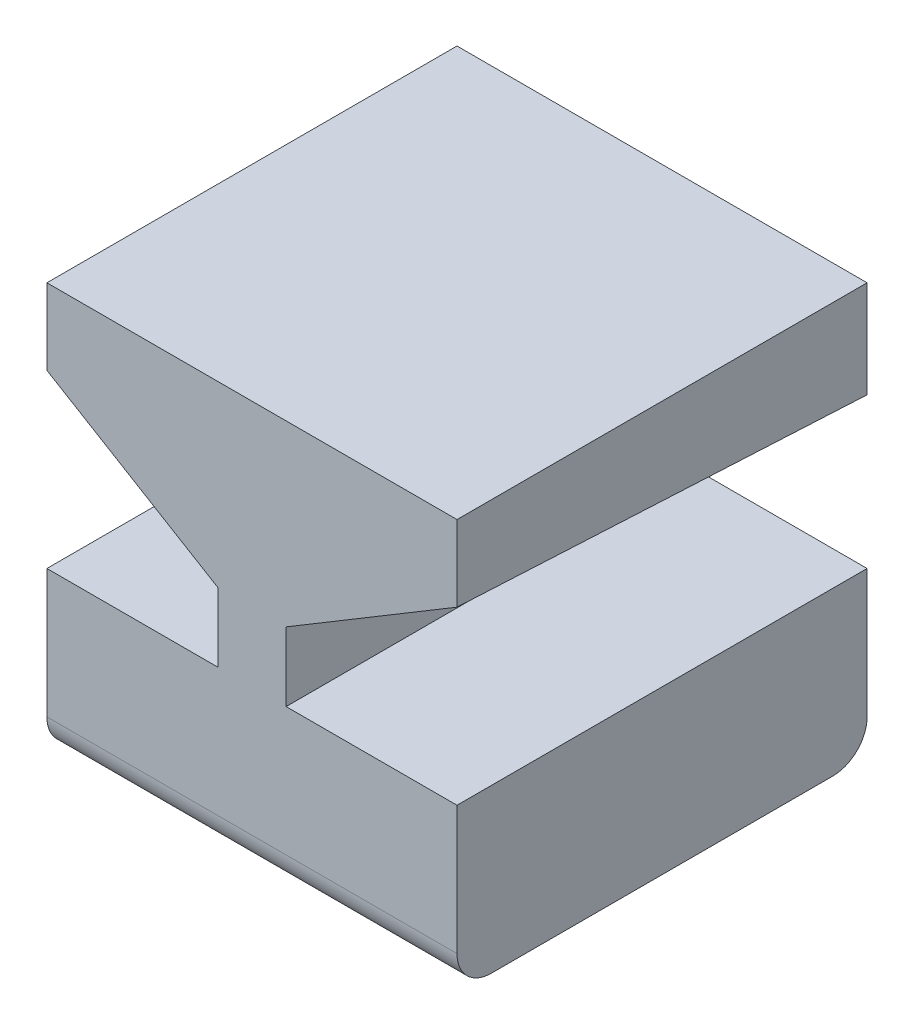
from build123d import *

# Parameters (mm, degrees)
BOSS_EXTRU_1_DEPTH      = 60
ENL_V_START             = 1.589213588
ENL_V_MAT_EXTRU_1_DEPTH = 60.853997617
CONG_1_R                = 5


# Read off the part's stored shape, not the designer's step: Enlèv. mat.-Extru.1
with BuildPart() as part:
    # Esquisse1 → Boss.-Extru.1 (new body)
    with BuildSketch(Plane.XY):
        Polygon((0, 0), (60, 0), (60, 23.8), (35, 23.8), (35, 30.8), (60, 45.8), (60, 60), (0, 60), (0, 45.8), (25, 30.8), (25, 23.8), (0, 23.8), align=None)
    extrude(amount=BOSS_EXTRU_1_DEPTH)

    # Enlèv. mat.-Extru.1 outline → Enlèv. mat.-Extru.1 (cut)
    with BuildSketch(Plane(origin=(0, 0, 0), x_dir=(1, 0, 0), z_dir=(0, 0.05159784377706792, 0.9986679440722813)).offset(ENL_V_START)):
        Polygon((60, 45.738991839), (35, 30.758972677), (35, 26), (60, 26), align=None)
        Polygon((0, 26), (25, 26), (25, 30.758972677), (0, 45.738991839), align=None)
    extrude(amount=ENL_V_MAT_EXTRU_1_DEPTH, mode=Mode.SUBTRACT)

    # Congé1
    cong_1_edges = [part.edges().sort_by_distance(p)[0] for p in [
        (30, 0, 0),
        (30, 0, 60),
    ]]
    fillet(cong_1_edges, radius=CONG_1_R)


solid = part.part
